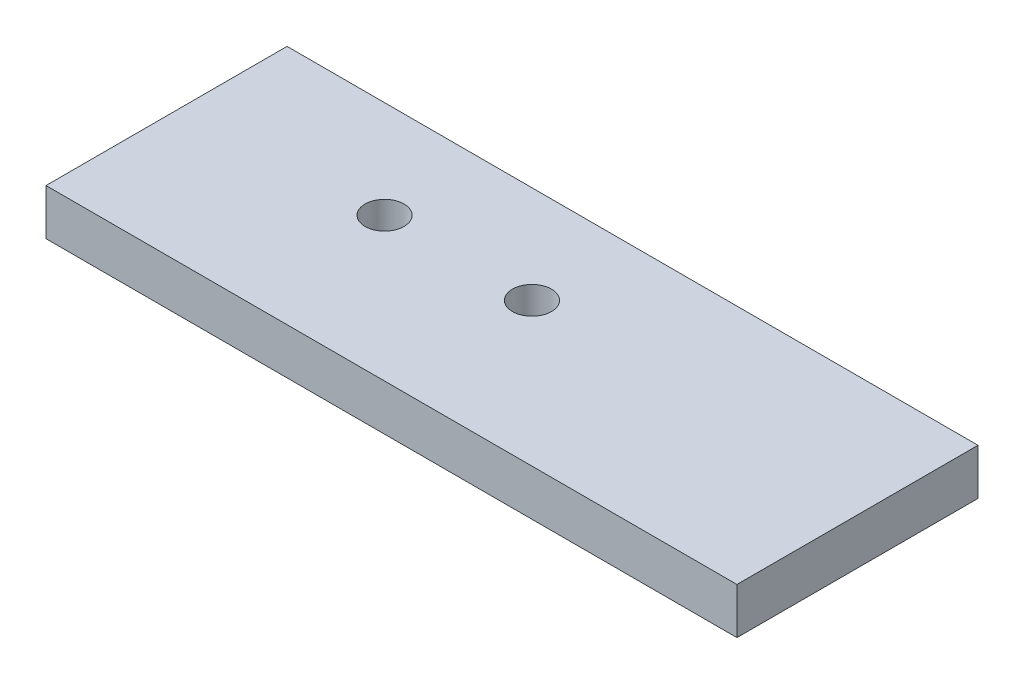
from build123d import *

# Parameters (mm, degrees)
SKETCH1_W               = 90
SKETCH1_H               = 31.4
BOSS_EXTRUDE1_DEPTH     = 6
CUT_EXTRUDE1_DEPTH      = 49.03634041
CUT_EXTRUDE1_DEPTH_BACK = 49.03634041
SKETCH2_R               = 2.54


with BuildPart() as part:
    # Sketch1 → Boss-Extrude1 (new body)
    with BuildSketch(Plane(origin=(0, 0, 0), x_dir=(1, 0, 0), z_dir=(0, 1, 0))):
        Rectangle(SKETCH1_W, SKETCH1_H)
    extrude(amount=BOSS_EXTRUDE1_DEPTH)

    # Sketch2 → Cut-Extrude1 (cut, two sides: drawn at the far end of the back side and taken through both)
    with BuildSketch(Plane(origin=(0, 6, 0), x_dir=(1, 0, 0), z_dir=(0, 1, 0)).offset(-CUT_EXTRUDE1_DEPTH_BACK)):
        with Locations((-0.4, 3)):
            Circle(SKETCH2_R)
        with Locations((-19.6, 3)):
            Circle(SKETCH2_R)
    extrude(amount=CUT_EXTRUDE1_DEPTH + CUT_EXTRUDE1_DEPTH_BACK, mode=Mode.SUBTRACT)


solid = part.part
